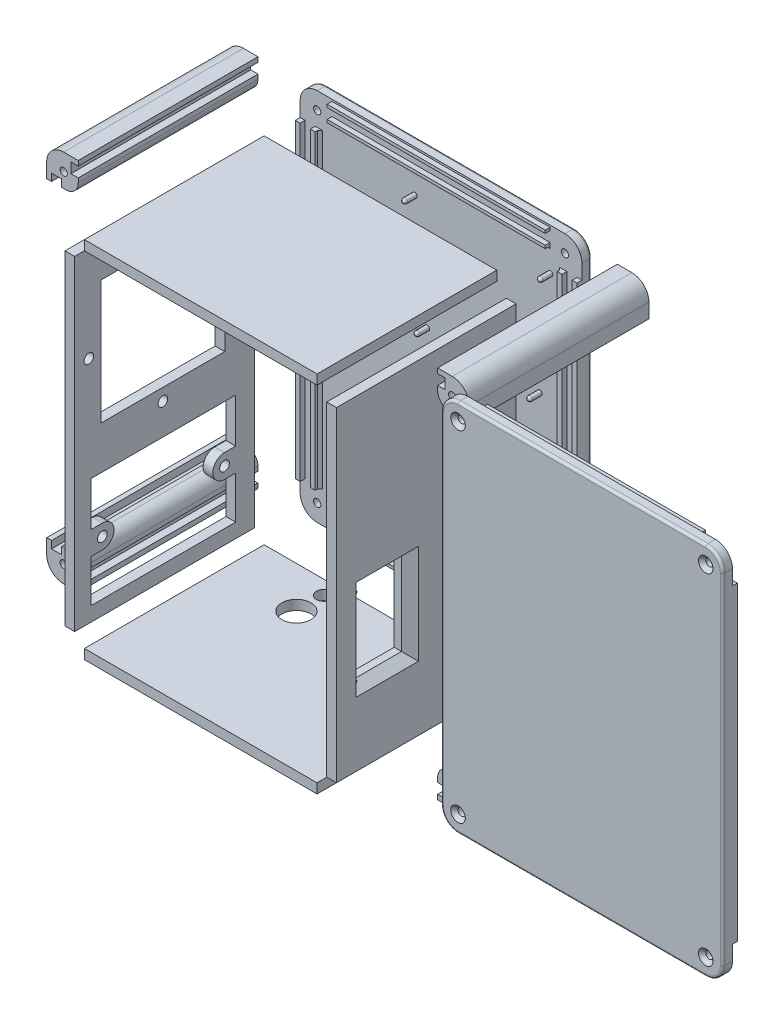
from build123d import *

# Parameters (mm, degrees)
EXTRUDE_1_DEPTH     = 74
SKETCH_1_R          = 1.5
EXTRUDE_1_2_DEPTH   = 74
EXTRUDE_1_3_DEPTH   = 74
EXTRUDE_1_4_DEPTH   = 74
EXTRUDE_1_5_DEPTH   = 74
SKETCH_1_W          = 4
SKETCH_1_H          = 133.8
EXTRUDE_1_6_DEPTH   = 74
SKETCH_1_W_2        = 95.8
SKETCH_1_H_2        = 4
EXTRUDE_1_7_DEPTH   = 74
EXTRUDE_1_8_DEPTH   = 74
EXTRUDE_3_DEPTH     = 4
SKETCH_4_W          = 2
SKETCH_4_H          = 127.8
SKETCH_4_W_2        = 89.8
SKETCH_4_H_2        = 1.214622068
EXTRUDE_4_DEPTH     = 2
SKETCH_5_R          = 1.5
CUT_EXTRUDE_1_DEPTH = 136.68028188
MOVE_BODY_2_ANGLE   = 180
SKETCH_7_R          = 1
SKETCH_7_R_2        = 1.5
EXTRUDE_5_DEPTH     = 5
SKETCH_8_R          = 2
SKETCH_8_W          = 51
SKETCH_8_H          = 51
CUT_EXTRUDE_2_DEPTH = 279.609312284
SKETCH_9_R          = 3
SKETCH_9_R_2        = 6
CUT_EXTRUDE_3_DEPTH = 5
SKETCH_10_W         = 3.3
SKETCH_10_H         = 15
SKETCH_10_W_2       = 19.67
SKETCH_10_H_2       = 35
CUT_EXTRUDE_4_DEPTH = 5
SKETCH_10_3_R       = 1
CUT_EXTRUDE_5_DEPTH = 3
SKETCH_10_4_W       = 19.67
SKETCH_10_4_H       = 35
SKETCH_10_4_R       = 1
SKETCH_10_4_R_2     = 2.65
EXTRUDE_6_DEPTH     = 3
CHAMFER_1_SIZE      = 3
CHAMFER_1_SIZE2     = 4
FILLET_1_R          = 1
FILLET_2_R          = 1
CHAMFER_4_SIZE      = 1
CHAMFER_2_SIZE      = 1.5
CHAMFER_3_SIZE      = 1.5
FILLET_3_R          = 1


with BuildPart() as part:
    # Эскиз1 → Бобышка-Вытянуть1 (new body)
    with BuildSketch(Plane.XY):
        Polygon((-59.9, 51.891691184), (-59.9, -15.008308816), (-59.9, -81.908308816), (-55.9, -81.908308816), (-55.9, 51.891691184), align=None)
    extrude(amount=EXTRUDE_1_DEPTH)

    # Эскиз8 → Вырез-Вытянуть2 (cut, through all)
    with BuildSketch(Plane(origin=(-55.9, 0, 0), x_dir=(0, 0, -1), z_dir=(1, 0, 0))):
        with Locations(Location((-37.677161712, 43.046583986, 0), (0, 0, 90))):
            Circle(SKETCH_8_R)
        with Locations(Location((-7.177161712, 12.546583986, 0), (0, 0, 90))):
            Circle(SKETCH_8_R)
        with Locations(Location((-37.677161712, -17.953416014, 0), (0, 0, 90))):
            Circle(SKETCH_8_R)
        with Locations(Location((-68.177161712, 12.546583986, 0), (0, 0, 90))):
            Circle(SKETCH_8_R)
        with Locations(Location((-62.592609193, -53.693430684, 0), (0, 0, 90))):
            Circle(SKETCH_8_R)
        with Locations(Location((-12.292609193, -53.693430684, 0), (0, 0, 90))):
            Circle(SKETCH_8_R)
        with Locations((-37.677161712, 12.546583986)):
            Rectangle(SKETCH_8_W, SKETCH_8_H)
        with BuildLine():
            Line((-7.692609193, -30.693430684), (-7.692609193, -48.893703138))
            Line((-7.692609193, -48.893703138), (-12.34375655, -48.893703138))
            ThreePointArc((-12.34375655, -48.893703138), (-17.092543121, -53.71862706), (-12.293364535, -58.493430684))
            Line((-12.293364535, -58.493430684), (-7.692609193, -58.493430684))
            Line((-7.692609193, -58.493430684), (-7.692609193, -76.008308816))
            Line((-7.692609193, -76.008308816), (-67.192609193, -76.008308816))
            Line((-67.192609193, -76.008308816), (-67.192609193, -58.493345607))
            Line((-67.192609193, -58.493345607), (-62.600713274, -58.493345607))
            ThreePointArc((-62.600713274, -58.493345607), (-57.792753561, -53.71862706), (-62.550320842, -48.893695208))
            Line((-62.550320842, -48.893695208), (-67.192609193, -48.893695208))
            Line((-67.192609193, -48.893695208), (-67.192609193, -30.693430684))
            Line((-67.192609193, -30.693430684), (-7.692609193, -30.693430684))
        make_face()
    extrude(amount=-CUT_EXTRUDE_2_DEPTH, mode=Mode.SUBTRACT)


with BuildPart() as body_2:
    # Эскиз1 → Extrude 1 2 (new body)
    with BuildSketch(Plane.XY):
        with BuildLine():
            Line((-55.8, -82.008308816), (-60, -82.008308816))
            Line((-60, -82.008308816), (-60, -79.008308816))
            Line((-60, -79.008308816), (-61, -79.008308816))
            Line((-61, -79.008308816), (-62, -79.008308816))
            Line((-62, -79.008308816), (-62, -85.008308816))
            ThreePointArc((-62, -85.008308816), (-59.949747468, -89.958056284), (-55, -92.008308816))
            Line((-55, -92.008308816), (-49, -92.008308816))
            Line((-49, -92.008308816), (-49, -90.008308816))
            Line((-49, -90.008308816), (-52, -90.008308816))
            Line((-52, -90.008308816), (-52, -85.808308816))
            Line((-52, -85.808308816), (-49, -85.808308816))
            Line((-49, -85.808308816), (-49, -84.008308816))
            ThreePointArc((-49, -84.008308816), (-50.464466094, -80.47277491), (-54, -79.008308816))
            Line((-54, -79.008308816), (-55.8, -79.008308816))
            Line((-55.8, -79.008308816), (-55.8, -82.008308816))
        make_face()
        with Locations((-55, -85.008308816)):
            Circle(SKETCH_1_R, mode=Mode.SUBTRACT)
    extrude(amount=EXTRUDE_1_2_DEPTH)


with BuildPart() as body_3:
    # Эскиз1 → Extrude 1 3 (new body)
    with BuildSketch(Plane.XY):
        with BuildLine():
            Line((-49, 61.991691184), (-55, 61.991691184))
            ThreePointArc((-55, 61.991691184), (-59.949747468, 59.941438652), (-62, 54.991691184))
            Line((-62, 54.991691184), (-62, 48.991691184))
            Line((-62, 48.991691184), (-60, 48.991691184))
            Line((-60, 48.991691184), (-60, 51.991691184))
            Line((-60, 51.991691184), (-55.8, 51.991691184))
            Line((-55.8, 51.991691184), (-55.8, 48.991691184))
            Line((-55.8, 48.991691184), (-54, 48.991691184))
            ThreePointArc((-54, 48.991691184), (-50.464466094, 50.456157278), (-49, 53.991691184))
            Line((-49, 53.991691184), (-49, 55.791691184))
            Line((-49, 55.791691184), (-52, 55.791691184))
            Line((-52, 55.791691184), (-52, 59.991691184))
            Line((-52, 59.991691184), (-49, 59.991691184))
            Line((-49, 59.991691184), (-49, 61.991691184))
        make_face()
        with Locations((-55, 54.991691184)):
            Circle(SKETCH_1_R, mode=Mode.SUBTRACT)
    extrude(amount=EXTRUDE_1_3_DEPTH)


with BuildPart() as body_4:
    # Эскиз1 → Extrude 1 4 (new body)
    with BuildSketch(Plane.XY):
        with BuildLine():
            Line((54, 48.991691184), (54, 54.991691184))
            ThreePointArc((54, 54.991691184), (51.949747468, 59.941438652), (47, 61.991691184))
            Line((47, 61.991691184), (41, 61.991691184))
            Line((41, 61.991691184), (41, 59.991691184))
            Line((41, 59.991691184), (44, 59.991691184))
            Line((44, 59.991691184), (44, 55.791691184))
            Line((44, 55.791691184), (41, 55.791691184))
            Line((41, 55.791691184), (41, 53.991691184))
            ThreePointArc((41, 53.991691184), (42.464466094, 50.456157278), (46, 48.991691184))
            Line((46, 48.991691184), (47.8, 48.991691184))
            Line((47.8, 48.991691184), (47.8, 51.991691184))
            Line((47.8, 51.991691184), (52, 51.991691184))
            Line((52, 51.991691184), (52, 48.991691184))
            Line((52, 48.991691184), (54, 48.991691184))
        make_face()
        with Locations((47, 54.991691184)):
            Circle(SKETCH_1_R, mode=Mode.SUBTRACT)
    extrude(amount=EXTRUDE_1_4_DEPTH)


with BuildPart() as body_5:
    # Эскиз1 → Extrude 1 5 (new body)
    with BuildSketch(Plane.XY):
        with BuildLine():
            Line((44, -85.808308816), (44, -90.008308816))
            Line((44, -90.008308816), (41, -90.008308816))
            Line((41, -90.008308816), (41, -92.008308816))
            Line((41, -92.008308816), (47, -92.008308816))
            ThreePointArc((47, -92.008308816), (51.949747468, -89.958056284), (54, -85.008308816))
            Line((54, -85.008308816), (54, -79.008308816))
            Line((54, -79.008308816), (52, -79.008308816))
            Line((52, -79.008308816), (52, -82.008308816))
            Line((52, -82.008308816), (47.8, -82.008308816))
            Line((47.8, -82.008308816), (47.8, -79.008308816))
            Line((47.8, -79.008308816), (46, -79.008308816))
            ThreePointArc((46, -79.008308816), (42.464466094, -80.47277491), (41, -84.008308816))
            Line((41, -84.008308816), (41, -85.808308816))
            Line((41, -85.808308816), (44, -85.808308816))
        make_face()
        with Locations((47, -85.008308816)):
            Circle(SKETCH_1_R, mode=Mode.SUBTRACT)
    extrude(amount=EXTRUDE_1_5_DEPTH)


with BuildPart() as body_6:
    # Эскиз1 → Extrude 1 6 (new body)
    with BuildSketch(Plane.XY):
        with Locations((49.9, -15.008308816)):
            Rectangle(SKETCH_1_W, SKETCH_1_H)
    extrude(amount=EXTRUDE_1_6_DEPTH)

    # Эскиз10 → Вырез-Вытянуть4 (cut)
    with BuildSketch(Plane.ZY.offset(-47.9)):
        with Locations((13.65049746, -35.119787152)):
            Rectangle(SKETCH_10_W, SKETCH_10_H)
        with Locations((53.070898011, -34.966774474)):
            Rectangle(SKETCH_10_W_2, SKETCH_10_H_2)
    extrude(amount=-CUT_EXTRUDE_4_DEPTH, mode=Mode.SUBTRACT)

    # Эскиз10<3> → Вырез-Вытянуть5 (cut)
    with BuildSketch(Plane.ZY.offset(-47.9)):
        with Locations(Location((65.605898011, -18.986774474, 0), (0, 0, 270))):
            Circle(SKETCH_10_3_R)
        with Locations(Location((65.605898011, -50.946774474, 0), (0, 0, 270))):
            Circle(SKETCH_10_3_R)
        with Locations(Location((37.205898011, -18.986774474, 0), (0, 0, 270))):
            Circle(SKETCH_10_3_R)
        with Locations(Location((37.205898011, -50.946774474, 0), (0, 0, 270))):
            Circle(SKETCH_10_3_R)
    extrude(amount=-CUT_EXTRUDE_5_DEPTH, mode=Mode.SUBTRACT)

    # Эскиз10<4> → Бобышка-Вытянуть6 (add)
    # profile 1 of 3: a face of its own
    with BuildSketch(Plane.ZY.offset(-47.9)):
        with BuildLine():
            Line((64.305898011, -16.066774474), (41.835898011, -16.066774474))
            Line((41.835898011, -16.066774474), (41.835898011, -53.866774474))
            Line((41.835898011, -53.866774474), (64.305898011, -53.866774474))
            Line((64.305898011, -53.866774474), (64.305898011, -53.255995122))
            ThreePointArc((64.305898011, -53.255995122), (68.255898011, -50.946774474), (64.305898011, -48.637553826))
            Line((64.305898011, -48.637553826), (64.305898011, -21.295995122))
            ThreePointArc((64.305898011, -21.295995122), (68.255898011, -18.986774474), (64.305898011, -16.677553826))
            Line((64.305898011, -16.677553826), (64.305898011, -16.066774474))
        make_face()
        with Locations((53.070898011, -34.966774474)):
            Rectangle(SKETCH_10_4_W, SKETCH_10_4_H, mode=Mode.SUBTRACT)
        with Locations(Location((65.605898011, -18.986774474, 0), (0, 0, 270))):
            Circle(SKETCH_10_4_R, mode=Mode.SUBTRACT)
        with Locations(Location((65.605898011, -50.946774474, 0), (0, 0, 270))):
            Circle(SKETCH_10_4_R, mode=Mode.SUBTRACT)
    # profile 2 of 3: a face of its own
    with BuildSketch(Plane.ZY.offset(-47.9)):
        with Locations(Location((37.205898011, -18.986774474, 0), (0, 0, 90))):
            Circle(SKETCH_10_4_R_2)
        with Locations(Location((37.205898011, -18.986774474, 0), (0, 0, 270))):
            Circle(SKETCH_10_4_R, mode=Mode.SUBTRACT)
    # profile 3 of 3: a face of its own
    with BuildSketch(Plane.ZY.offset(-47.9)):
        with Locations(Location((37.205898011, -50.946774474, 0), (0, 0, 90))):
            Circle(SKETCH_10_4_R_2)
        with Locations(Location((37.205898011, -50.946774474, 0), (0, 0, 270))):
            Circle(SKETCH_10_4_R, mode=Mode.SUBTRACT)
    extrude(amount=EXTRUDE_6_DEPTH)

    # Фаска1
    chamfer_1_edges = [body_6.edges().sort_by_distance(p)[0] for p in [
        (51.9, -17.466774474, 53.070898011),
        (51.9, -34.966774474, 62.905898011),
        (51.9, -52.466774474, 53.070898011),
        (51.9, -34.966774474, 43.235898011),
    ]]
    chamfer_1_side = [body_6.faces().sort_by_distance(p)[0] for p in [
        (51.9, -13.400154083, 35.918701404),
    ]]
    chamfer(chamfer_1_edges, length=CHAMFER_1_SIZE, length2=CHAMFER_1_SIZE2, reference=chamfer_1_side[0])


with BuildPart() as body_7:
    # Эскиз1 → Extrude 1 7 (new body)
    with BuildSketch(Plane.XY):
        with Locations((-4, -87.908308816)):
            Rectangle(SKETCH_1_W_2, SKETCH_1_H_2)
    extrude(amount=EXTRUDE_1_7_DEPTH)

    # Эскиз9 → Вырез-Вытянуть3 (cut)
    with BuildSketch(Plane(origin=(0, -85.908308816, 0), x_dir=(1, 0, 0), z_dir=(0, 1, 0))):
        with Locations(Location((-21.538273808, -5.793393457, 0), (0, 0, 270))):
            Circle(SKETCH_9_R)
        with Locations(Location((-21.538273808, -17.059101871, 0), (0, 0, 270))):
            Circle(SKETCH_9_R_2)
    extrude(amount=-CUT_EXTRUDE_3_DEPTH, mode=Mode.SUBTRACT)


with BuildPart() as body_8:
    # Эскиз1 → Extrude 1 8 (new body)
    with BuildSketch(Plane.XY):
        with Locations((-4, 57.891691184)):
            Rectangle(SKETCH_1_W_2, SKETCH_1_H_2)
    extrude(amount=EXTRUDE_1_8_DEPTH)


with BuildPart() as body_9:
    # Эскиз3 → Бобышка-Вытянуть3 (new body)
    with BuildSketch(Plane(origin=(0, 0, -0.1), x_dir=(-1, 0, 0), z_dir=(0, 0, -1))):
        with BuildLine():
            Line((-41, 61.991691184), (-47, 61.991691184))
            ThreePointArc((-47, 61.991691184), (-51.949747468, 59.941438652), (-54, 54.991691184))
            Line((-54, 54.991691184), (-54, 48.991691184))
            Line((-54, 48.991691184), (-54, -79.008308816))
            Line((-54, -79.008308816), (-54, -85.008308816))
            ThreePointArc((-54, -85.008308816), (-51.949747468, -89.958056284), (-47, -92.008308816))
            Line((-47, -92.008308816), (-41, -92.008308816))
            Line((-41, -92.008308816), (49, -92.008308816))
            Line((49, -92.008308816), (55, -92.008308816))
            ThreePointArc((55, -92.008308816), (59.949747468, -89.958056284), (62, -85.008308816))
            Line((62, -85.008308816), (62, -79.008308816))
            Line((62, -79.008308816), (62, 48.991691184))
            Line((62, 48.991691184), (62, 54.991691184))
            ThreePointArc((62, 54.991691184), (59.949747468, 59.941438652), (55, 61.991691184))
            Line((55, 61.991691184), (49, 61.991691184))
            Line((49, 61.991691184), (-41, 61.991691184))
        make_face()
    extrude(amount=EXTRUDE_3_DEPTH)

    # Эскиз4 → Бобышка-Вытянуть4 (add)
    with BuildSketch(Plane.XY.offset(-0.1)):
        with Locations((-61, -15.008308816)):
            Rectangle(SKETCH_4_W, SKETCH_4_H)
        with Locations((46.8, -15.008308816)):
            Rectangle(SKETCH_4_W, SKETCH_4_H)
        with Locations((-4, 60.599002218)):
            Rectangle(SKETCH_4_W_2, SKETCH_4_H_2)
        with Locations((53, -15.008308816)):
            Rectangle(SKETCH_4_W, SKETCH_4_H)
        with Locations((-4, -90.61561985)):
            Rectangle(SKETCH_4_W_2, SKETCH_4_H_2)
        with Locations((-54.8, -15.008308816)):
            Rectangle(SKETCH_4_W, SKETCH_4_H)
        with Locations((-4, 55.18438015)):
            Rectangle(SKETCH_4_W_2, SKETCH_4_H_2)
        with Locations((-4, -85.200997782)):
            Rectangle(SKETCH_4_W_2, SKETCH_4_H_2)
    extrude(amount=EXTRUDE_4_DEPTH)

    # Эскиз5 → Вырез-Вытянуть1 (cut, through all)
    with BuildSketch(Plane(origin=(0, 0, -4.1), x_dir=(-1, 0, 0), z_dir=(0, 0, -1))):
        with Locations((-47, 54.991691184)):
            Circle(SKETCH_5_R)
        with Locations((55, 54.991691184)):
            Circle(SKETCH_5_R)
        with Locations((55, -85.008308816)):
            Circle(SKETCH_5_R)
        with Locations((-47, -85.008308816)):
            Circle(SKETCH_5_R)
    extrude(amount=-CUT_EXTRUDE_1_DEPTH, mode=Mode.SUBTRACT)


with BuildPart() as body_10:
    # Move Body 1: copy of body 9
    add(body_9.part.moved(Location((140, 0, 80))))


with BuildPart() as body_10_1:
    # Move Body 2: moved
    add(body_10.part.rotate(Axis((0, -15.008308816, 78.9), (1, 0, 0)), MOVE_BODY_2_ANGLE))

    # Скругление1
    fillet_1_edges = [body_10_1.edges().sort_by_distance(p)[0] for p in [
        (191.949747468, 59.941438652, 81.9),
        (136, 61.991691184, 81.9),
        (80.050252532, 59.941438652, 81.9),
        (78, -15.008308816, 81.9),
        (191.949747468, -89.958056284, 81.9),
        (80.050252532, -89.958056284, 81.9),
        (136, -92.008308816, 81.9),
        (194, -15.008308816, 81.9),
    ]]
    fillet(fillet_1_edges, radius=FILLET_1_R)

    # Фаска3
    chamfer_3_edges = [body_10_1.edges().sort_by_distance(p)[0] for p in [
        (188.5, 54.991691184, 81.9),
        (86.5, 54.991691184, 81.9),
        (86.5, -85.008308816, 81.9),
        (188.5, -85.008308816, 81.9),
    ]]
    chamfer(chamfer_3_edges, length=CHAMFER_3_SIZE)


with BuildPart() as body_9_1:
    add(body_9.part)

    # Эскиз7 → Бобышка-Вытянуть5 (add)
    with BuildSketch(Plane.XY.offset(-0.1)):
        with Locations(Location((-9.704155161, 0.082371281, 0), (0, 0, 180))):
            Circle(SKETCH_7_R)
        with Locations(Location((36.675844839, 0.082371281, 0), (0, 0, 180))):
            Circle(SKETCH_7_R)
        with Locations(Location((-9.704155161, -16.117628719, 0), (0, 0, 180))):
            Circle(SKETCH_7_R)
        with Locations(Location((36.675844839, -16.117628719, 0), (0, 0, 180))):
            Circle(SKETCH_7_R)
        with Locations(Location((42.46180924, -70.066950509, 0), (0, 0, 180))):
            Circle(SKETCH_7_R_2)
        with Locations(Location((-9.83819076, -75.166950509, 0), (0, 0, 180))):
            Circle(SKETCH_7_R_2)
        with Locations(Location((-8.88819076, -26.766950509, 0), (0, 0, 180))):
            Circle(SKETCH_7_R_2)
        with Locations(Location((42.46180924, -42.066950509, 0), (0, 0, 180))):
            Circle(SKETCH_7_R_2)
        with Locations(Location((41.060645872, 44.817668559, 0), (0, 0, 180))):
            Circle(SKETCH_7_R)
        with Locations(Location((41.060645872, 18.937668559, 0), (0, 0, 180))):
            Circle(SKETCH_7_R)
        with Locations(Location((-14.819354128, 44.817668559, 0), (0, 0, 180))):
            Circle(SKETCH_7_R)
        with Locations(Location((-14.819354128, 18.937668559, 0), (0, 0, 180))):
            Circle(SKETCH_7_R)
    extrude(amount=EXTRUDE_5_DEPTH)

    # Скругление2
    fillet_2_edges = [body_9_1.edges().sort_by_distance(p)[0] for p in [
        (51.949747468, -89.958056284, -4.1),
        (-4, -92.008308816, -4.1),
        (-59.949747468, -89.958056284, -4.1),
        (-62, -15.008308816, -4.1),
        (51.949747468, 59.941438652, -4.1),
        (-59.949747468, 59.941438652, -4.1),
        (-4, 61.991691184, -4.1),
        (54, -15.008308816, -4.1),
    ]]
    fillet(fillet_2_edges, radius=FILLET_2_R)

    # Фаска4
    chamfer_4_edges = [body_9_1.edges().sort_by_distance(p)[0] for p in [
        (-53.8, -15.008308816, -0.1),
        (-4, 54.577069116, -0.1),
        (-4, -84.593686748, -0.1),
        (45.8, -15.008308816, -0.1),
    ]]
    chamfer(chamfer_4_edges, length=CHAMFER_4_SIZE)

    # Фаска2
    chamfer_2_edges = [body_9_1.edges().sort_by_distance(p)[0] for p in [
        (48.5, -85.008308816, -4.1),
        (-53.5, -85.008308816, -4.1),
        (-53.5, 54.991691184, -4.1),
        (48.5, 54.991691184, -4.1),
    ]]
    chamfer(chamfer_2_edges, length=CHAMFER_2_SIZE)

    # Скругление3
    fillet_3_edges = [body_9_1.edges().sort_by_distance(p)[0] for p in [
        (-8.704155161, 0.082371281, 4.9),
        (37.675844839, 0.082371281, 4.9),
        (-8.704155161, -16.117628719, 4.9),
        (37.675844839, -16.117628719, 4.9),
        (43.96180924, -70.066950509, 4.9),
        (-8.33819076, -75.166950509, 4.9),
        (-7.38819076, -26.766950509, 4.9),
        (43.96180924, -42.066950509, 4.9),
        (42.060645872, 44.817668559, 4.9),
        (42.060645872, 18.937668559, 4.9),
        (-13.819354128, 44.817668559, 4.9),
        (-13.819354128, 18.937668559, 4.9),
    ]]
    fillet(fillet_3_edges, radius=FILLET_3_R)


with BuildPart() as body_3_1:
    # Move Body 9: moved
    add(body_3.part.moved(Location((-30.269666071, 0, 0))))


with BuildPart() as body_2_1:
    # Move Body 9: moved
    add(body_2.part.moved(Location((-30.269666071, 0, 0))))


with BuildPart() as body_5_1:
    # Move Body 10: moved
    add(body_5.part.moved(Location((27.708300381, 0, 0))))


with BuildPart() as body_4_1:
    # Move Body 10: moved
    add(body_4.part.moved(Location((27.708300381, 0, 0))))


with BuildPart() as part_1:
    # Move Body 11: moved
    add(part.part.moved(Location((0, 0, 24.852659259))))


with BuildPart() as body_8_1:
    # Move Body 11: moved
    add(body_8.part.moved(Location((0, 0, 24.852659259))))


with BuildPart() as body_6_1:
    # Move Body 11: moved
    add(body_6.part.moved(Location((0, 0, 24.852659259))))


with BuildPart() as body_7_1:
    # Move Body 11: moved
    add(body_7.part.moved(Location((0, 0, 24.852659259))))


solid = Compound([body_10_1.part, body_9_1.part, body_3_1.part, body_2_1.part, body_5_1.part, body_4_1.part, part_1.part, body_8_1.part, body_6_1.part, body_7_1.part])
